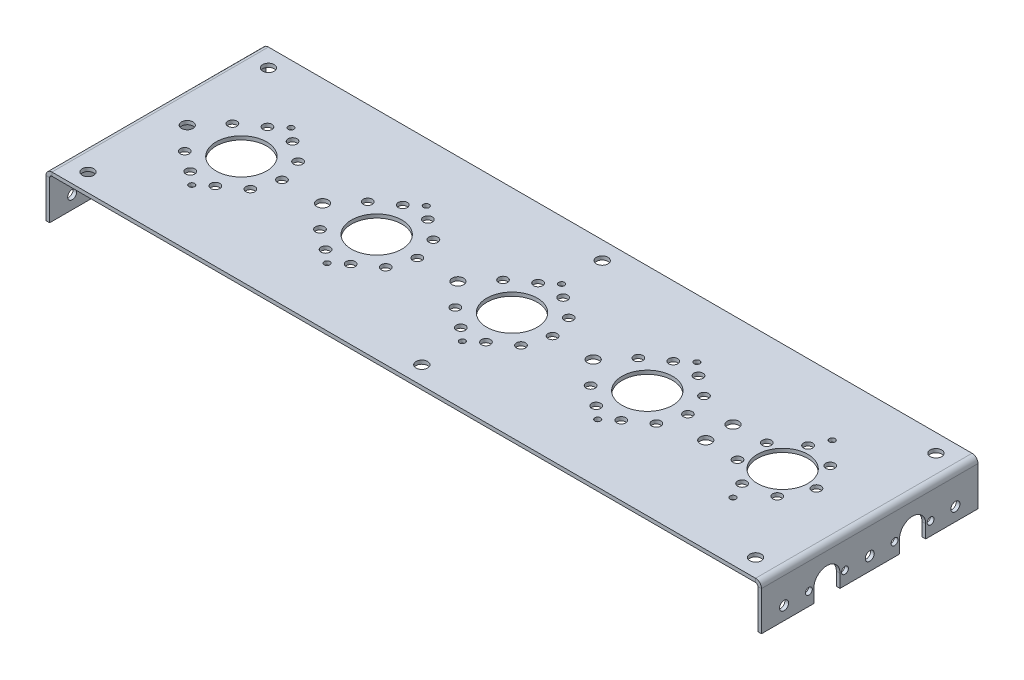
from build123d import *

# Parameters (mm, degrees)
SKETCH1_W               = 390
SKETCH1_H               = 120
SKETCH1_R               = 3.2
SKETCH1_R_2             = 14
SKETCH1_R_3             = 3.175
SKETCH1_R_4             = 1.6
BOSS_EXTRUDE1_DEPTH     = 2.03
EDGE_FLANGE1_DEPTH      = 120
EDGE_FLANGE1_BEND_DEPTH = 120
CUT_EXTRUDE1_DEPTH      = 209.447861347
CUT_EXTRUDE1_DEPTH_BACK = 209.447861347
SKETCH17_R              = 2.5
SKETCH18_R              = 1.9
CUT_EXTRUDE2_DEPTH      = 2.03
SKETCH19_R              = 2.5
CUT_EXTRUDE3_DEPTH      = 2.03


# Sheet-metal steps are written as plain solids
with BuildPart() as part:
    # Sketch1 → Boss-Extrude1 (new body)
    with BuildSketch(Plane(origin=(0, 0, 0), x_dir=(1, 0, 0), z_dir=(0, 1, 0))):
        Rectangle(SKETCH1_W, SKETCH1_H)
        with Locations(Location((-185, 50, 0), (0, 0, 270))):
            Circle(SKETCH1_R, mode=Mode.SUBTRACT)
        with Locations(Location((0, 50, 0), (0, 0, 270))):
            Circle(SKETCH1_R, mode=Mode.SUBTRACT)
        with Locations(Location((185, 50, 0), (0, 0, 270))):
            Circle(SKETCH1_R, mode=Mode.SUBTRACT)
        with Locations(Location((185, -50, 0), (0, 0, 270))):
            Circle(SKETCH1_R, mode=Mode.SUBTRACT)
        with Locations(Location((0, -50, 0), (0, 0, 270))):
            Circle(SKETCH1_R, mode=Mode.SUBTRACT)
        with Locations(Location((-185, -50, 0), (0, 0, 270))):
            Circle(SKETCH1_R, mode=Mode.SUBTRACT)
        with Locations(Location((150, 0, 0), (0, 0, 270))):
            Circle(SKETCH1_R_2, mode=Mode.SUBTRACT)
        with Locations(Location((75, 0, 0), (0, 0, 270))):
            Circle(SKETCH1_R_2, mode=Mode.SUBTRACT)
        with Locations(Location((0, 0, 0), (0, 0, 270))):
            Circle(SKETCH1_R_2, mode=Mode.SUBTRACT)
        with Locations(Location((-75, 0, 0), (0, 0, 270))):
            Circle(SKETCH1_R_2, mode=Mode.SUBTRACT)
        with Locations(Location((-150, 0, 0), (0, 0, 270))):
            Circle(SKETCH1_R_2, mode=Mode.SUBTRACT)
        with Locations(Location((-105, 0, 0), (0, 0, 270))):
            Circle(SKETCH1_R_3, mode=Mode.SUBTRACT)
        with Locations(Location((-30, 0, 0), (0, 0, 270))):
            Circle(SKETCH1_R_3, mode=Mode.SUBTRACT)
        with Locations(Location((45, 0, 0), (0, 0, 270))):
            Circle(SKETCH1_R_3, mode=Mode.SUBTRACT)
        with Locations(Location((-180, 0, 0), (0, 0, 270))):
            Circle(SKETCH1_R_3, mode=Mode.SUBTRACT)
        with Locations(Location((114.948, 7.564, 0), (0, 0, 270))):
            Circle(SKETCH1_R_3, mode=Mode.SUBTRACT)
        with Locations(Location((114.947, -7.548, 0), (0, 0, 270))):
            Circle(SKETCH1_R_3, mode=Mode.SUBTRACT)
        with Locations(Location((75, 27.5, 0), (0, 0, 270))):
            Circle(SKETCH1_R_4, mode=Mode.SUBTRACT)
        with Locations(Location((75, -27.5, 0), (0, 0, 270))):
            Circle(SKETCH1_R_4, mode=Mode.SUBTRACT)
        with Locations(Location((150.013625, -27.503339919, 0), (0, 0, 270))):
            Circle(SKETCH1_R_4, mode=Mode.SUBTRACT)
        with Locations(Location((150, 27.5, 0), (0, 0, 270))):
            Circle(SKETCH1_R_4, mode=Mode.SUBTRACT)
        with Locations(Location((-75, 27.5, 0), (0, 0, 270))):
            Circle(SKETCH1_R_4, mode=Mode.SUBTRACT)
        with Locations(Location((-75, -27.5, 0), (0, 0, 270))):
            Circle(SKETCH1_R_4, mode=Mode.SUBTRACT)
        with Locations(Location((-150, -27.5, 0), (0, 0, 270))):
            Circle(SKETCH1_R_4, mode=Mode.SUBTRACT)
        with Locations(Location((-150, 27.5, 0), (0, 0, 270))):
            Circle(SKETCH1_R_4, mode=Mode.SUBTRACT)
        with Locations(Location((0, -27.5, 0), (0, 0, 270))):
            Circle(SKETCH1_R_4, mode=Mode.SUBTRACT)
        with Locations(Location((0, 27.5, 0), (0, 0, 270))):
            Circle(SKETCH1_R_4, mode=Mode.SUBTRACT)
    extrude(amount=BOSS_EXTRUDE1_DEPTH)

    # Edge-Flange1 section (across the edge) → Edge-Flange1 (add)
    with BuildSketch(Plane(origin=(196.27, 0, -60), x_dir=(-1, 0, 0), z_dir=(0, 0, 1))):
        with BuildLine():
            Line((-2.03, 1.27), (-2.03, 22.97))
            Line((-2.03, 22.97), (0, 22.97))
            Line((0, 22.97), (0, 1.27))
            ThreePointArc((0, 1.27), (0.371974388, 0.371974388), (1.27, 0))
            Line((1.27, 0), (1.27, -2.03))
            ThreePointArc((1.27, -2.03), (-1.063452378, -1.063452378), (-2.03, 1.27))
        make_face()
    extrude(amount=EDGE_FLANGE1_DEPTH)

    # Edge-Flange1 section 2 (across the edge) → Edge-Flange1 bend (add)
    with BuildSketch(Plane(origin=(-196.27, 0, 60), x_dir=(1, 0, 0), z_dir=(0, 0, -1))):
        with BuildLine():
            Line((-2.03, 1.27), (-2.03, 22.97))
            Line((-2.03, 22.97), (0, 22.97))
            Line((0, 22.97), (0, 1.27))
            ThreePointArc((0, 1.27), (0.371974388, 0.371974388), (1.27, 0))
            Line((1.27, 0), (1.27, -2.03))
            ThreePointArc((1.27, -2.03), (-1.063452378, -1.063452378), (-2.03, 1.27))
        make_face()
    extrude(amount=EDGE_FLANGE1_BEND_DEPTH)

    # Sketch17 → Cut-Extrude1 (cut, two sides: drawn at the far end of the back side and taken through both)
    with BuildSketch(Plane(origin=(0, 0, 0), x_dir=(0, 0, -1), z_dir=(1, 0, 0)).offset(-CUT_EXTRUDE1_DEPTH_BACK)):
        with Locations((-47.5, -15.65)):
            Circle(SKETCH17_R)
        with Locations((0, -15.65)):
            Circle(SKETCH17_R)
        with Locations((47.5, -15.65)):
            Circle(SKETCH17_R)
    extrude(amount=CUT_EXTRUDE1_DEPTH + CUT_EXTRUDE1_DEPTH_BACK, mode=Mode.SUBTRACT)

    # Sketch18 → Cut-Extrude2 (cut)
    with BuildSketch(Plane(origin=(198.3, 0, 0), x_dir=(0, 0, -1), z_dir=(1, 0, 0))):
        with Locations(Location((33.75, -15.65, 0), (0, 0, 90))):
            Circle(SKETCH18_R)
        with Locations(Location((13.75, -15.65, 0), (0, 0, 90))):
            Circle(SKETCH18_R)
        with Locations(Location((-13.75, -15.65, 0), (0, 0, 270))):
            Circle(SKETCH18_R)
        with Locations(Location((-33.75, -15.65, 0), (0, 0, 270))):
            Circle(SKETCH18_R)
        with BuildLine():
            Line((16.5, -15.65), (16.5, -25.65))
            Line((16.5, -25.65), (31, -25.65))
            Line((31, -25.65), (31, -15.65))
            ThreePointArc((31, -15.65), (23.75, -8.4), (16.5, -15.65))
        make_face()
        with BuildLine():
            Line((-31, -25.65), (-31, -15.65))
            ThreePointArc((-31, -15.65), (-23.75, -8.4), (-16.5, -15.65))
            Line((-16.5, -15.65), (-16.5, -25.65))
            Line((-16.5, -25.65), (-31, -25.65))
        make_face()
    extrude(amount=-CUT_EXTRUDE2_DEPTH, mode=Mode.SUBTRACT)

    # Sketch19 → Cut-Extrude3 (cut)
    with BuildSketch(Plane(origin=(0, 2.03, 0), x_dir=(1, 0, 0), z_dir=(0, 1, 0))):
        with Locations(Location((-127.5, 0, 0), (0, 0, 270))):
            Circle(SKETCH19_R)
        with Locations(Location((-131.797117627, -13.225168177, 0), (0, 0, 270))):
            Circle(SKETCH19_R)
        with Locations(Location((-143.047117627, -21.398771617, 0), (0, 0, 270))):
            Circle(SKETCH19_R)
        with Locations(Location((-156.952882373, -21.398771617, 0), (0, 0, 270))):
            Circle(SKETCH19_R)
        with Locations(Location((-168.202882373, -13.225168177, 0), (0, 0, 270))):
            Circle(SKETCH19_R)
        with Locations(Location((-168.202882373, 13.225168177, 0), (0, 0, 270))):
            Circle(SKETCH19_R)
        with Locations(Location((-156.952882373, 21.398771617, 0), (0, 0, 270))):
            Circle(SKETCH19_R)
        with Locations(Location((-143.047117627, 21.398771617, 0), (0, 0, 270))):
            Circle(SKETCH19_R)
        with Locations(Location((-131.797117627, 13.225168177, 0), (0, 0, 270))):
            Circle(SKETCH19_R)
        with Locations(Location((-52.5, 0, 0), (0, 0, 270))):
            Circle(SKETCH19_R)
        with Locations(Location((-56.797117627, -13.225168177, 0), (0, 0, 270))):
            Circle(SKETCH19_R)
        with Locations(Location((-68.047117627, -21.398771617, 0), (0, 0, 270))):
            Circle(SKETCH19_R)
        with Locations(Location((-81.952882373, -21.398771617, 0), (0, 0, 270))):
            Circle(SKETCH19_R)
        with Locations(Location((-93.202882373, -13.225168177, 0), (0, 0, 270))):
            Circle(SKETCH19_R)
        with Locations(Location((-93.202882373, 13.225168177, 0), (0, 0, 270))):
            Circle(SKETCH19_R)
        with Locations(Location((-81.952882373, 21.398771617, 0), (0, 0, 270))):
            Circle(SKETCH19_R)
        with Locations(Location((-68.047117627, 21.398771617, 0), (0, 0, 270))):
            Circle(SKETCH19_R)
        with Locations(Location((-56.797117627, 13.225168177, 0), (0, 0, 270))):
            Circle(SKETCH19_R)
        with Locations(Location((22.5, 0, 0), (0, 0, 270))):
            Circle(SKETCH19_R)
        with Locations(Location((18.202882373, -13.225168177, 0), (0, 0, 270))):
            Circle(SKETCH19_R)
        with Locations(Location((6.952882373, -21.398771617, 0), (0, 0, 270))):
            Circle(SKETCH19_R)
        with Locations(Location((-6.952882373, -21.398771617, 0), (0, 0, 270))):
            Circle(SKETCH19_R)
        with Locations(Location((-18.202882373, -13.225168177, 0), (0, 0, 270))):
            Circle(SKETCH19_R)
        with Locations(Location((-18.202882373, 13.225168177, 0), (0, 0, 270))):
            Circle(SKETCH19_R)
        with Locations(Location((-6.952882373, 21.398771617, 0), (0, 0, 270))):
            Circle(SKETCH19_R)
        with Locations(Location((6.952882373, 21.398771617, 0), (0, 0, 270))):
            Circle(SKETCH19_R)
        with Locations(Location((18.202882373, 13.225168177, 0), (0, 0, 270))):
            Circle(SKETCH19_R)
        with Locations(Location((97.5, 0, 0), (0, 0, 270))):
            Circle(SKETCH19_R)
        with Locations(Location((93.202882373, -13.225168177, 0), (0, 0, 270))):
            Circle(SKETCH19_R)
        with Locations(Location((81.952882373, -21.398771617, 0), (0, 0, 270))):
            Circle(SKETCH19_R)
        with Locations(Location((68.047117627, -21.398771617, 0), (0, 0, 270))):
            Circle(SKETCH19_R)
        with Locations(Location((56.797117627, -13.225168177, 0), (0, 0, 270))):
            Circle(SKETCH19_R)
        with Locations(Location((56.797117627, 13.225168177, 0), (0, 0, 270))):
            Circle(SKETCH19_R)
        with Locations(Location((68.047117627, 21.398771617, 0), (0, 0, 270))):
            Circle(SKETCH19_R)
        with Locations(Location((81.952882373, 21.398771617, 0), (0, 0, 270))):
            Circle(SKETCH19_R)
        with Locations(Location((93.202882373, 13.225168177, 0), (0, 0, 270))):
            Circle(SKETCH19_R)
        with Locations(Location((168.75, 0, 0), (0, 0, 270))):
            Circle(SKETCH19_R)
        with Locations(Location((161.690433785, -14.659340296, 0), (0, 0, 270))):
            Circle(SKETCH19_R)
        with Locations(Location((145.827732488, -18.279898353, 0), (0, 0, 270))):
            Circle(SKETCH19_R)
        with Locations(Location((133.106833727, -8.135320108, 0), (0, 0, 270))):
            Circle(SKETCH19_R)
        with Locations(Location((133.106833727, 8.135320108, 0), (0, 0, 270))):
            Circle(SKETCH19_R)
        with Locations(Location((145.827732488, 18.279898353, 0), (0, 0, 270))):
            Circle(SKETCH19_R)
        with Locations(Location((161.690433785, 14.659340296, 0), (0, 0, 270))):
            Circle(SKETCH19_R)
    extrude(amount=-CUT_EXTRUDE3_DEPTH, mode=Mode.SUBTRACT)


solid = part.part
